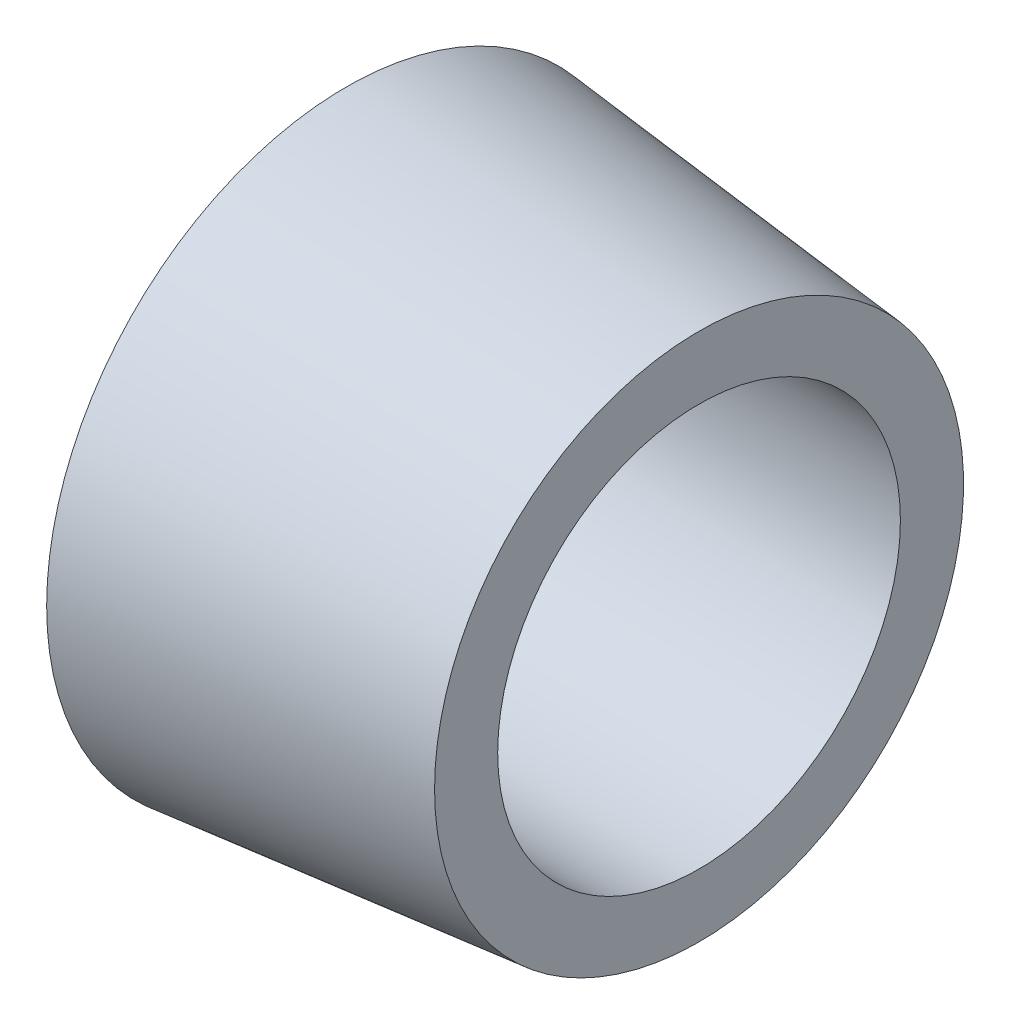
from build123d import *


with BuildPart() as part:
    # Sketch1 → Revolve1 (revolve)
    with BuildSketch(Plane.XY):
        Polygon((0, 14.5034), (25.4, 14.5034), (25.4, 19.05), (0, 21.59), align=None)
    revolve(axis=Axis((-1.27, 0, 0), (1, 0, 0)))


solid = part.part
